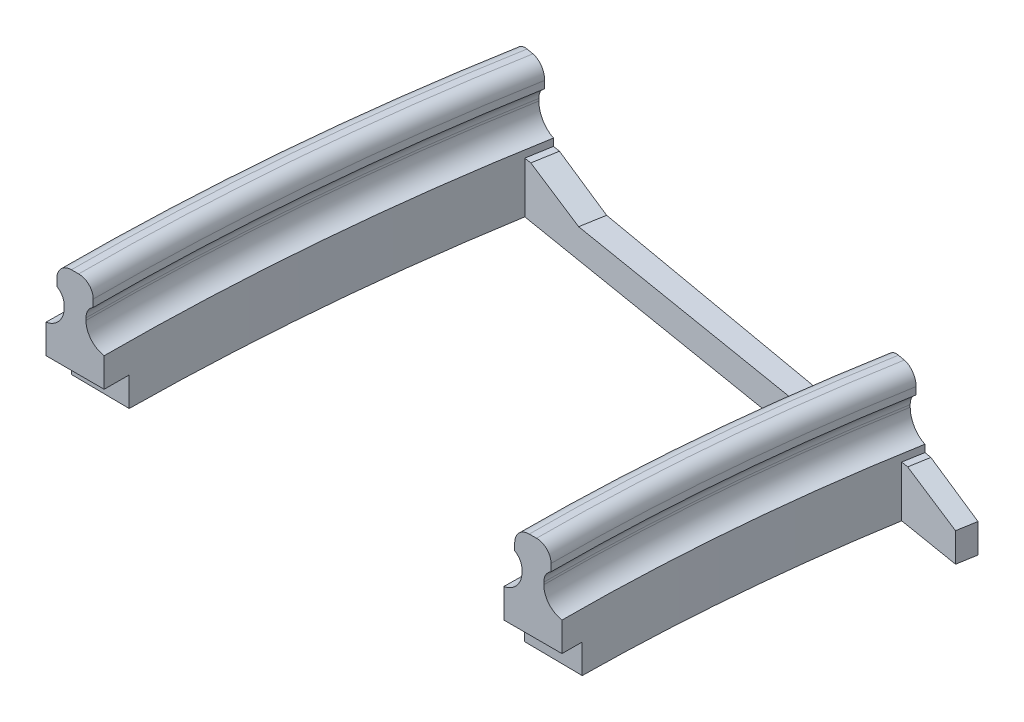
from build123d import *

# Parameters (mm, degrees)
REVOLVE_1_ANGLE     = 10
FILLET_1_R          = 1.5
FILLET_2_R          = 1.5
FILLET_3_R          = 1
FILLET_4_R          = 1
SKETCH_7_W          = 4
SKETCH_7_H          = 2
CUT_REVOLVE_1_ANGLE = 0.6
SKETCH_10_R         = 0.4
CUT_EXTRUDE_1_DEPTH = 2
REVOLVE_2_ANGLE     = 0.6


with BuildPart() as part:
    # 草图4 → 旋转1 (revolve)
    with BuildSketch(Plane.XY):
        Polygon((0.75, -1.5), (1.25, -1.5), (1.25, 0), (0, 0), (-1.25, 0), (-1.25, -1.5), (-0.75, -1.5), (-0.75, -4), (-2, -4), (-2, -8), (0, -8), (2, -8), (2, -4), (0.75, -4), align=None)
        Polygon((31.5, 0), (32.75, 0), (32.75, -1.5), (32.25, -1.5), (32.25, -4), (33.5, -4), (33.5, -8), (31.5, -8), (29.5, -8), (29.5, -4), (30.75, -4), (30.75, -1.5), (30.25, -1.5), (30.25, 0), align=None)
    revolve(axis=Axis((165.75, 3.853460973, 0), (0, -1, 0)), revolution_arc=REVOLVE_1_ANGLE)

    # 圆角1
    # the kernel refuses this fillet: 1.5 mm, written as the material it adds along each edge
    with BuildSketch(Plane(origin=(165.75, -4, 0), x_dir=(-1, 0, 0), z_dir=(0, 0, 1))) as fillet_1_piece_1:
        with BuildLine():
            CenterArc((163.5, -1.479019946), FILLET_1_R, 0, 80.405931773)
            Line((165, -1.479019946), (165.03, -1.479019946))
            Line((165.03, -1.479019946), (165.03, 0))
            Line((165.03, 0), (165, 0.03))
            ThreePointArc((165, 0.03), (164.375, 0.03), (163.755, 0.029580399))
            Line((163.755, 0.029580399), (163.75, 0))
        make_face()
    revolve(axis=Axis((165.75, -4, 0), (0, -1, 0)), revolution_arc=10)
    with BuildSketch(Plane(origin=(165.75, -4, 0), x_dir=(-1, 0, 0), z_dir=(0, 0, 1))) as fillet_1_piece_2:
        with BuildLine():
            CenterArc((168, -1.479019946), FILLET_1_R, 99.594068227, 80.405931773)
            Line((166.5, -1.479019946), (166.47, -1.479019946))
            Line((166.47, -1.479019946), (166.47, 0))
            Line((166.47, 0), (166.5, 0.03))
            ThreePointArc((166.5, 0.03), (167.125, 0.03), (167.745, 0.029580399))
            Line((167.745, 0.029580399), (167.75, 0))
        make_face()
    revolve(axis=Axis((165.75, -4, 0), (0, -1, 0)), revolution_arc=10)

    # 圆角2
    # the kernel refuses this fillet: 1.5 mm, written as the material it adds along each edge
    with BuildSketch(Plane(origin=(165.75, -4, 0), x_dir=(-1, 0, 0), z_dir=(0, 0, 1))) as fillet_2_piece_1:
        with BuildLine():
            CenterArc((136.5, -1.479019946), FILLET_2_R, 99.594068227, 80.405931773)
            Line((136.25, 0), (136.245, 0.029580399))
            ThreePointArc((136.245, 0.029580399), (135.625, 0.03), (135, 0.03))
            Line((135, 0.03), (134.97, 0))
            Line((134.97, 0), (134.97, -1.479019946))
            Line((134.97, -1.479019946), (135, -1.479019946))
        make_face()
    revolve(axis=Axis((165.75, -4, 0), (0, -1, 0)), revolution_arc=10)
    with BuildSketch(Plane(origin=(165.75, -4, 0), x_dir=(-1, 0, 0), z_dir=(0, 0, 1))) as fillet_2_piece_2:
        with BuildLine():
            CenterArc((132, -1.479019946), FILLET_2_R, 0, 80.405931773)
            Line((133.5, -1.479019946), (133.53, -1.479019946))
            Line((133.53, -1.479019946), (133.53, 0))
            Line((133.53, 0), (133.5, 0.03))
            ThreePointArc((133.5, 0.03), (132.875, 0.03), (132.255, 0.029580399))
            Line((132.255, 0.029580399), (132.25, 0))
        make_face()
    revolve(axis=Axis((165.75, -4, 0), (0, -1, 0)), revolution_arc=10)

    # 圆角3
    # the kernel refuses this fillet: 1 mm, written as the material it adds along each edge
    with BuildSketch(Plane(origin=(165.75, -1.5, 0), x_dir=(-1, 0, 0), z_dir=(0, 0, 1))) as fillet_3_piece_1:
        with BuildLine():
            CenterArc((136, 0.866025404), FILLET_3_R, 180, 60)
            Line((135, 0.866025404), (135, 0))
            Line((135, 0), (135.5, 0))
        make_face()
    revolve(axis=Axis((165.75, -1.5, 0), (0, -1, 0)), revolution_arc=10)
    with BuildSketch(Plane(origin=(165.75, -1.5, 0), x_dir=(-1, 0, 0), z_dir=(0, 0, 1))) as fillet_3_piece_2:
        with BuildLine():
            CenterArc((132.5, 0.866025404), FILLET_3_R, 300, 60)
            Line((133, 0), (133.5, 0))
            Line((133.5, 0), (133.5, 0.866025404))
        make_face()
    revolve(axis=Axis((165.75, -1.5, 0), (0, -1, 0)), revolution_arc=10)
    # the kernel refuses this fillet: 1 mm, written as the material it takes off along each edge
    with BuildSketch(Plane(origin=(165.75, 0, 0), x_dir=(-0.9998233399867428, 0, 0.018795978765534377), z_dir=(0.018795978765534377, 0, 0.9998233399867428))) as fillet_3_2_piece_1:
        with BuildLine():
            CenterArc((133 + FILLET_3_R, FILLET_3_R), FILLET_3_R, 180, 90)
            Line((133, FILLET_3_R), (133, 0))
            Line((133, 0), (133 + FILLET_3_R, 0))
        make_face()
    revolve(axis=Axis((165.75, 0, 0), (0, -1, 0)), revolution_arc=12.153987353, mode=Mode.SUBTRACT)
    with BuildSketch(Plane(origin=(165.75, 0, 0), x_dir=(-0.9998297984864879, 0, 0.01844922921070363), z_dir=(0.01844922921070363, 0, 0.9998297984864879))) as fillet_3_2_piece_2:
        with BuildLine():
            CenterArc((135.5 - FILLET_3_R, FILLET_3_R), FILLET_3_R, 270, 90)
            Line((135.5 - FILLET_3_R, 0), (135.5, 0))
            Line((135.5, 0), (135.5, FILLET_3_R))
        make_face()
    revolve(axis=Axis((165.75, 0, 0), (0, -1, 0)), revolution_arc=12.114245889, mode=Mode.SUBTRACT)

    # 圆角4
    # the kernel refuses this fillet: 1 mm, written as the material it adds along each edge
    with BuildSketch(Plane(origin=(165.75, -1.5, 0), x_dir=(-1, 0, 0), z_dir=(0, 0, 1))) as fillet_4_piece_1:
        with BuildLine():
            CenterArc((167.5, 0.866025404), FILLET_4_R, 180, 60)
            Line((167, 0), (166.5, 0))
            Line((166.5, 0), (166.5, 0.866025404))
        make_face()
    revolve(axis=Axis((165.75, -1.5, 0), (0, -1, 0)), revolution_arc=10)
    with BuildSketch(Plane(origin=(165.75, -1.5, 0), x_dir=(-1, 0, 0), z_dir=(0, 0, 1))) as fillet_4_piece_2:
        with BuildLine():
            CenterArc((164, 0.866025404), FILLET_4_R, 300, 60)
            Line((164.5, 0), (165, 0))
            Line((165, 0), (165, 0.866025404))
        make_face()
    revolve(axis=Axis((165.75, -1.5, 0), (0, -1, 0)), revolution_arc=10)
    # the kernel refuses this fillet: 1 mm, written as the material it takes off along each edge
    with BuildSketch(Plane(origin=(165.75, 0, 0), x_dir=(-0.9998845180351503, 0, 0.015197058715919934), z_dir=(0.015197058715919934, 0, 0.9998845180351503))) as fillet_4_2_piece_1:
        with BuildLine():
            CenterArc((164.5 + FILLET_4_R, FILLET_4_R), FILLET_4_R, 180, 90)
            Line((164.5, FILLET_4_R), (164.5, 0))
            Line((164.5, 0), (164.5 + FILLET_4_R, 0))
        make_face()
    revolve(axis=Axis((165.75, 0, 0), (0, -1, 0)), revolution_arc=11.74152169, mode=Mode.SUBTRACT)
    with BuildSketch(Plane(origin=(165.75, 0, 0), x_dir=(-0.9998879496351009, 0, 0.014969574961036002), z_dir=(0.014969574961036002, 0, 0.9998879496351009))) as fillet_4_2_piece_2:
        with BuildLine():
            CenterArc((167 - FILLET_4_R, FILLET_4_R), FILLET_4_R, 270, 90)
            Line((167 - FILLET_4_R, 0), (167, 0))
            Line((167, 0), (167, FILLET_4_R))
        make_face()
    revolve(axis=Axis((165.75, 0, 0), (0, -1, 0)), revolution_arc=11.715451006, mode=Mode.SUBTRACT)

    # 草图7 → 切除-旋转1 (revolve, cut)
    with BuildSketch(Plane.XY):
        with Locations((0, -7)):
            Rectangle(SKETCH_7_W, SKETCH_7_H)
        with Locations((31.5, -7)):
            Rectangle(SKETCH_7_W, SKETCH_7_H)
    revolve(axis=Axis((165.75, 3.853460973, 0), (0, -1, 0)), revolution_arc=CUT_REVOLVE_1_ANGLE, mode=Mode.SUBTRACT)

    # 草图10 → 切除-拉伸1 (cut)
    with BuildSketch(Plane.XZ.offset(6)):
        with Locations(Location((0.00227206, -0.867861005, 0), (0, 0, 270))):
            Circle(SKETCH_10_R)
        with Locations(Location((31.501840266, -0.702928144, 0), (0, 0, 270))):
            Circle(SKETCH_10_R)
    extrude(amount=-CUT_EXTRUDE_1_DEPTH, mode=Mode.SUBTRACT)

    # 草图11 → 旋转2 (revolve)
    with BuildSketch(Plane(origin=(4.997974052, 0, -28.344919378), x_dir=(-0.9848077530122081, 0, -0.17364817766693072), z_dir=(0.17364817766693072, 0, -0.9848077530122081))):
        Polygon((-26.981885062, -4.5), (-26.481885062, -4.5), (-22.481885062, -6), (-3.981885062, -6), (0.018114938, -4.5), (0.518114938, -4.5), (4.518114938, -4.5), (5.018114938, -4.5), (9.018114938, -6), (9.018114938, -8), (4.518114938, -8), (0.518114938, -8), (-26.981885062, -8), (-30.981885062, -8), (-35.481885062, -8), (-35.481885062, -6), (-31.481885062, -4.5), (-30.981885062, -4.5), align=None)
    revolve(axis=Axis((165.75, 3.853460973, 0), (0, 1, 0)), revolution_arc=REVOLVE_2_ANGLE)


solid = part.part
